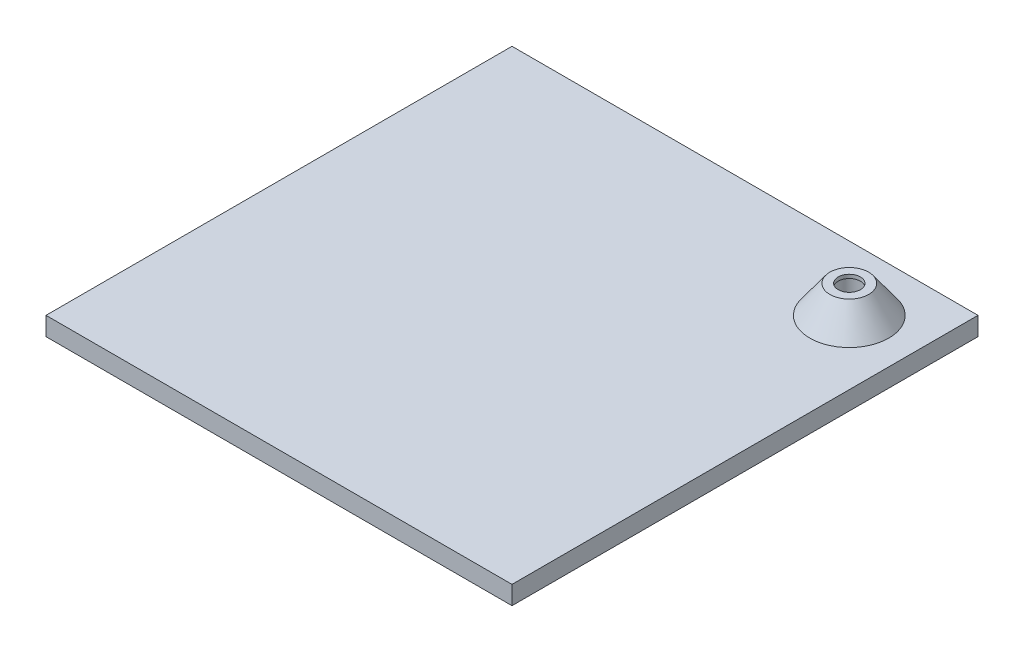
from build123d import *

# Parameters (mm, degrees)
SKETCH1_W           = 126
SKETCH1_H           = 126
BOSS_EXTRUDE1_DEPTH = 5
SKETCH3_R           = 12.5
BOSS_EXTRUDE2_DEPTH = 7.5
SKETCH4_R           = 3.45
CUT_EXTRUDE1_DEPTH  = 11.5
SKETCH6_R           = 3
CUT_EXTRUDE2_DEPTH  = 179.628805068
CHAMFER1_SIZE       = 10
CHAMFER1_SIZE_2     = 7.26542528


with BuildPart() as part:
    # Sketch1 → Boss-Extrude1 (new body)
    with BuildSketch(Plane(origin=(0, 0, 0), x_dir=(1, 0, 0), z_dir=(0, 1, 0))):
        with Locations((63, 63)):
            Rectangle(SKETCH1_W, SKETCH1_H)
    extrude(amount=BOSS_EXTRUDE1_DEPTH)

    # Sketch3 → Boss-Extrude2 (add)
    with BuildSketch(Plane(origin=(0, 5, 0), x_dir=(1, 0, 0), z_dir=(0, 1, 0))):
        with Locations(Location((108.6, 108.6, 0), (0, 0, 90))):
            Circle(SKETCH3_R)
    extrude(amount=BOSS_EXTRUDE2_DEPTH)

    # Sketch4 → Cut-Extrude1 (cut)
    with BuildSketch(Plane.XZ):
        with Locations(Location((108.6, -108.6, 0), (0, 0, 270))):
            Circle(SKETCH4_R)
    extrude(amount=-CUT_EXTRUDE1_DEPTH, mode=Mode.SUBTRACT)

    # Sketch6 → Cut-Extrude2 (cut, through all)
    with BuildSketch(Plane(origin=(0, 12.5, 0), x_dir=(1, 0, 0), z_dir=(0, 1, 0))):
        with Locations(Location((108.6, 108.6, 0), (0, 0, 270))):
            Circle(SKETCH6_R)
    extrude(amount=-CUT_EXTRUDE2_DEPTH, mode=Mode.SUBTRACT)

    # Chamfer1
    # the kernel refuses this chamfer: 10, 7.26542528 mm, written as the material it takes off along each edge
    with BuildSketch(Plane(origin=(108.6, 12.5, -108.6), x_dir=(0, 0, -1), z_dir=(1, 0, 0))) as chamfer1_piece_1_section:
        Polygon((12.5, -CHAMFER1_SIZE), (12.5 - CHAMFER1_SIZE_2, 0), (12.5, 0), align=None)
    chamfer1_piece_1 = revolve(axis=Axis((108.6, 12.5, -108.6), (0, 1, 0)), mode=Mode.PRIVATE)
    chamfer1_piece_1 = split(chamfer1_piece_1, bisect_by=Plane(origin=(108.6, 5, -100.650989912), z_dir=(0, 1, 0)), keep=Keep.TOP, mode=Mode.PRIVATE)
    add(chamfer1_piece_1, mode=Mode.SUBTRACT)


solid = part.part
